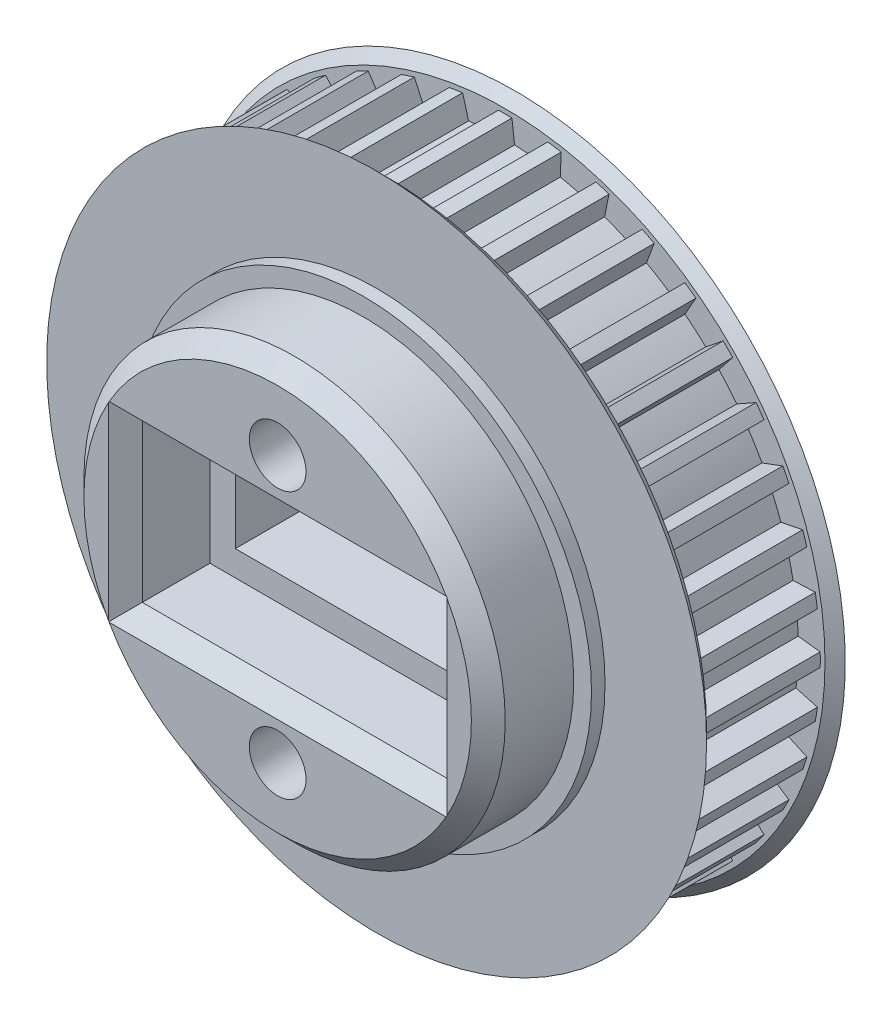
from build123d import *
from build123d.topology import SkipClean

# Parameters (mm, degrees)
CROQUIS1_R                 = 2
SALIENTE_EXTRUIR1_DEPTH    = 7
CROQUIS2_R                 = 19.5
CROQUIS2_R_2               = 2
SALIENTE_EXTRUIR2_DEPTH    = 0.6
SALIENTE_EXTRUIR4_START    = 5.8
CROQUIS4_R                 = 12.45
CROQUIS4_R_2               = 2
SALIENTE_EXTRUIR4_DEPTH    = 5.8
SALIENTE_EXTRUIR6_START    = 0.6
CROQUIS6_R                 = 19.5
CROQUIS6_R_2               = 2
SALIENTE_EXTRUIR6_DEPTH    = 0.6
SALIENTE_EXTRUIR5_START    = 0.6
CROQUIS5_R                 = 13.5
CROQUIS5_R_2               = 2
SALIENTE_EXTRUIR5_DEPTH    = 0.6
CROQUIS3_R                 = 12.45
CROQUIS3_R_2               = 2
SALIENTE_EXTRUIR7_DEPTH    = 5.85
CHAFL_N4_SIZE              = 1
CROQUIS7_R                 = 13.5
CROQUIS7_R_2               = 2
SALIENTE_EXTRUIR8_DEPTH    = 0.8
CORTAR_EXTRUIR1_DEPTH      = 31.682283161
CORTAR_EXTRUIR1_DEPTH_BACK = 31.682283161
CROQUIS8_R                 = 1.675
CROQUIS8_W                 = 15
CROQUIS8_H                 = 6.3
CORTAR_EXTRUIR2_DEPTH      = 5
REDONDEO1_R                = 2.5
CROQUIS10_W                = 18
CROQUIS10_H                = 9.3
CORTAR_EXTRUIR3_DEPTH      = 5
CHAFL_N5_SIZE              = 1
CHAFL_N6_SIZE              = 0.6


# Some blends are built 0.0001 mm under size
with BuildPart() as part:
    # Croquis1 → Saliente-Extruir1 (new body)
    with BuildSketch(Plane.XY):
        with BuildLine():
            Line((-0.4, 18.616701085), (-0.55, 17.312263428))
            ThreePointArc((-0.55, 17.312263428), (-1.358989825, 17.26760295), (-2.165006081, 17.185159693))
            Line((-2.165006081, 17.185159693), (-2.517218339, 18.450072388))
            Line((-2.517218339, 18.450072388), (-3.307369011, 18.324924816))
            Line((-3.307369011, 18.324924816), (-3.251463255, 17.013081781))
            ThreePointArc((-3.251463255, 17.013081781), (-4.043506635, 16.842417258), (-4.826702526, 16.634900292))
            Line((-4.826702526, 16.634900292), (-5.372454408, 17.829141677))
            Line((-5.372454408, 17.829141677), (-6.133299621, 17.581928081))
            Line((-6.133299621, 17.581928081), (-5.872864694, 16.294981598))
            ThreePointArc((-5.872864694, 16.294981598), (-6.628458892, 16.002515356), (-7.369549537, 15.675034438))
            Line((-7.369549537, 15.675034438), (-8.095402819, 16.769198326))
            Line((-8.095402819, 16.769198326), (-8.808208039, 16.406005926))
            Line((-8.808208039, 16.406005926), (-8.349656714, 15.175644888))
            ThreePointArc((-8.349656714, 15.175644888), (-9.050196493, 14.768578416), (-9.73093378, 14.329197213))
            Line((-9.73093378, 14.329197213), (-10.619015546, 15.296341658))
            Line((-10.619015546, 15.296341658), (-11.266229142, 14.826113456))
            Line((-11.266229142, 14.826113456), (-10.620852474, 13.682633435))
            ThreePointArc((-10.620852474, 13.682633435), (-11.24908822, 13.170990062), (-11.852710138, 12.630527597))
            Line((-11.852710138, 12.630527597), (-12.881152868, 13.446838293))
            ThreePointArc((-12.881152868, 13.446838293), (-13.167033821, 13.167033821), (-13.446838293, 12.881152868))
            Line((-13.446838293, 12.881152868), (-12.630527597, 11.852710138))
            ThreePointArc((-12.630527597, 11.852710138), (-13.170990062, 11.24908822), (-13.682633435, 10.620852474))
            Line((-13.682633435, 10.620852474), (-14.826113456, 11.266229142))
            ThreePointArc((-14.826113456, 11.266229142), (-15.064703677, 10.945147893), (-15.296341658, 10.619015546))
            Line((-15.296341658, 10.619015546), (-14.329197213, 9.73093378))
            ThreePointArc((-14.329197213, 9.73093378), (-14.768578416, 9.050196493), (-15.175644888, 8.349656714))
            Line((-15.175644888, 8.349656714), (-16.406005926, 8.808208039))
            ThreePointArc((-16.406005926, 8.808208039), (-16.591430532, 8.4537561), (-16.769198326, 8.095402819))
            Line((-16.769198326, 8.095402819), (-15.675034438, 7.369549537))
            ThreePointArc((-15.675034438, 7.369549537), (-16.002515356, 6.628458892), (-16.294981598, 5.872864694))
            Line((-16.294981598, 5.872864694), (-17.581928081, 6.133299621))
            ThreePointArc((-17.581928081, 6.133299621), (-17.709621303, 5.754204774), (-17.829141677, 5.372454408))
            Line((-17.829141677, 5.372454408), (-16.634900292, 4.826702526))
            ThreePointArc((-16.634900292, 4.826702526), (-16.842417258, 4.043506635), (-17.013081781, 3.251463255))
            Line((-17.013081781, 3.251463255), (-18.324924816, 3.307369011))
            ThreePointArc((-18.324924816, 3.307369011), (-18.391742423, 2.91296583), (-18.450072388, 2.517218339))
            Line((-18.450072388, 2.517218339), (-17.185159693, 2.165006081))
            ThreePointArc((-17.185159693, 2.165006081), (-17.26760295, 1.358989825), (-17.312263428, 0.55))
            Line((-17.312263428, 0.55), (-18.616701085, 0.4))
            ThreePointArc((-18.616701085, 0.4), (-18.620997806, 0), (-18.616701085, -0.4))
            Line((-18.616701085, -0.4), (-17.312263428, -0.55))
            ThreePointArc((-17.312263428, -0.55), (-17.26760295, -1.358989825), (-17.185159693, -2.165006081))
            Line((-17.185159693, -2.165006081), (-18.450072388, -2.517218339))
            ThreePointArc((-18.450072388, -2.517218339), (-18.391742423, -2.91296583), (-18.324924816, -3.307369011))
            Line((-18.324924816, -3.307369011), (-17.013081781, -3.251463255))
            ThreePointArc((-17.013081781, -3.251463255), (-16.842417258, -4.043506635), (-16.634900292, -4.826702526))
            Line((-16.634900292, -4.826702526), (-17.829141677, -5.372454408))
            ThreePointArc((-17.829141677, -5.372454408), (-17.709621303, -5.754204774), (-17.581928081, -6.133299621))
            Line((-17.581928081, -6.133299621), (-16.294981598, -5.872864694))
            ThreePointArc((-16.294981598, -5.872864694), (-16.002515356, -6.628458892), (-15.675034438, -7.369549537))
            Line((-15.675034438, -7.369549537), (-16.769198326, -8.095402819))
            ThreePointArc((-16.769198326, -8.095402819), (-16.591430532, -8.4537561), (-16.406005926, -8.808208039))
            Line((-16.406005926, -8.808208039), (-15.175644888, -8.349656714))
            ThreePointArc((-15.175644888, -8.349656714), (-14.768578416, -9.050196493), (-14.329197213, -9.73093378))
            Line((-14.329197213, -9.73093378), (-15.296341658, -10.619015546))
            ThreePointArc((-15.296341658, -10.619015546), (-15.064703677, -10.945147893), (-14.826113456, -11.266229142))
            Line((-14.826113456, -11.266229142), (-13.682633435, -10.620852474))
            ThreePointArc((-13.682633435, -10.620852474), (-13.170990062, -11.24908822), (-12.630527597, -11.852710138))
            Line((-12.630527597, -11.852710138), (-13.446838293, -12.881152868))
            ThreePointArc((-13.446838293, -12.881152868), (-13.167033821, -13.167033821), (-12.881152868, -13.446838293))
            Line((-12.881152868, -13.446838293), (-11.852710138, -12.630527597))
            ThreePointArc((-11.852710138, -12.630527597), (-11.24908822, -13.170990062), (-10.620852474, -13.682633435))
            Line((-10.620852474, -13.682633435), (-11.266229142, -14.826113456))
            ThreePointArc((-11.266229142, -14.826113456), (-10.945147893, -15.064703677), (-10.619015546, -15.296341658))
            Line((-10.619015546, -15.296341658), (-9.73093378, -14.329197213))
            ThreePointArc((-9.73093378, -14.329197213), (-9.050196493, -14.768578416), (-8.349656714, -15.175644888))
            Line((-8.349656714, -15.175644888), (-8.808208039, -16.406005926))
            ThreePointArc((-8.808208039, -16.406005926), (-8.4537561, -16.591430532), (-8.095402819, -16.769198326))
            Line((-8.095402819, -16.769198326), (-7.369549537, -15.675034438))
            ThreePointArc((-7.369549537, -15.675034438), (-6.628458892, -16.002515356), (-5.872864694, -16.294981598))
            Line((-5.872864694, -16.294981598), (-6.133299621, -17.581928081))
            ThreePointArc((-6.133299621, -17.581928081), (-5.754204774, -17.709621303), (-5.372454408, -17.829141677))
            Line((-5.372454408, -17.829141677), (-4.826702526, -16.634900292))
            ThreePointArc((-4.826702526, -16.634900292), (-4.043506635, -16.842417258), (-3.251463255, -17.013081781))
            Line((-3.251463255, -17.013081781), (-3.307369011, -18.324924816))
            ThreePointArc((-3.307369011, -18.324924816), (-2.91296583, -18.391742423), (-2.517218339, -18.450072388))
            Line((-2.517218339, -18.450072388), (-2.165006081, -17.185159693))
            ThreePointArc((-2.165006081, -17.185159693), (-1.358989825, -17.26760295), (-0.55, -17.312263428))
            Line((-0.55, -17.312263428), (-0.4, -18.616701085))
            ThreePointArc((-0.4, -18.616701085), (0, -18.620997806), (0.4, -18.616701085))
            Line((0.4, -18.616701085), (0.55, -17.312263428))
            ThreePointArc((0.55, -17.312263428), (1.358989825, -17.26760295), (2.165006081, -17.185159693))
            Line((2.165006081, -17.185159693), (2.517218339, -18.450072388))
            ThreePointArc((2.517218339, -18.450072388), (2.91296583, -18.391742423), (3.307369011, -18.324924816))
            Line((3.307369011, -18.324924816), (3.251463255, -17.013081781))
            ThreePointArc((3.251463255, -17.013081781), (4.043506635, -16.842417258), (4.826702526, -16.634900292))
            Line((4.826702526, -16.634900292), (5.372454408, -17.829141677))
            ThreePointArc((5.372454408, -17.829141677), (5.754204774, -17.709621303), (6.133299621, -17.581928081))
            Line((6.133299621, -17.581928081), (5.872864694, -16.294981598))
            ThreePointArc((5.872864694, -16.294981598), (6.628458892, -16.002515356), (7.369549537, -15.675034438))
            Line((7.369549537, -15.675034438), (8.095402819, -16.769198326))
            ThreePointArc((8.095402819, -16.769198326), (8.4537561, -16.591430532), (8.808208039, -16.406005926))
            Line((8.808208039, -16.406005926), (8.349656714, -15.175644888))
            ThreePointArc((8.349656714, -15.175644888), (9.050196493, -14.768578416), (9.73093378, -14.329197213))
            Line((9.73093378, -14.329197213), (10.619015546, -15.296341658))
            ThreePointArc((10.619015546, -15.296341658), (10.945147893, -15.064703677), (11.266229142, -14.826113456))
            Line((11.266229142, -14.826113456), (10.620852474, -13.682633435))
            ThreePointArc((10.620852474, -13.682633435), (11.24908822, -13.170990062), (11.852710138, -12.630527597))
            Line((11.852710138, -12.630527597), (12.881152868, -13.446838293))
            ThreePointArc((12.881152868, -13.446838293), (13.167033821, -13.167033821), (13.446838293, -12.881152868))
            Line((13.446838293, -12.881152868), (12.630527597, -11.852710138))
            ThreePointArc((12.630527597, -11.852710138), (13.170990062, -11.24908822), (13.682633435, -10.620852474))
            Line((13.682633435, -10.620852474), (14.826113456, -11.266229142))
            ThreePointArc((14.826113456, -11.266229142), (15.064703677, -10.945147893), (15.296341658, -10.619015546))
            Line((15.296341658, -10.619015546), (14.329197213, -9.73093378))
            ThreePointArc((14.329197213, -9.73093378), (14.768578416, -9.050196493), (15.175644888, -8.349656714))
            Line((15.175644888, -8.349656714), (16.406005926, -8.808208039))
            ThreePointArc((16.406005926, -8.808208039), (16.591430532, -8.4537561), (16.769198326, -8.095402819))
            Line((16.769198326, -8.095402819), (15.675034438, -7.369549537))
            ThreePointArc((15.675034438, -7.369549537), (16.002515356, -6.628458892), (16.294981598, -5.872864694))
            Line((16.294981598, -5.872864694), (17.581928081, -6.133299621))
            ThreePointArc((17.581928081, -6.133299621), (17.709621303, -5.754204774), (17.829141677, -5.372454408))
            Line((17.829141677, -5.372454408), (16.634900292, -4.826702526))
            ThreePointArc((16.634900292, -4.826702526), (16.842417258, -4.043506635), (17.013081781, -3.251463255))
            Line((17.013081781, -3.251463255), (18.324924816, -3.307369011))
            ThreePointArc((18.324924816, -3.307369011), (18.391742423, -2.91296583), (18.450072388, -2.517218339))
            Line((18.450072388, -2.517218339), (17.185159693, -2.165006081))
            ThreePointArc((17.185159693, -2.165006081), (17.26760295, -1.358989825), (17.312263428, -0.55))
            Line((17.312263428, -0.55), (18.616701085, -0.4))
            ThreePointArc((18.616701085, -0.4), (18.620997806, 0), (18.616701085, 0.4))
            Line((18.616701085, 0.4), (17.312263428, 0.55))
            ThreePointArc((17.312263428, 0.55), (17.26760295, 1.358989825), (17.185159693, 2.165006081))
            Line((17.185159693, 2.165006081), (18.450072388, 2.517218339))
            ThreePointArc((18.450072388, 2.517218339), (18.391742423, 2.91296583), (18.324924816, 3.307369011))
            Line((18.324924816, 3.307369011), (17.013081781, 3.251463255))
            ThreePointArc((17.013081781, 3.251463255), (16.842417258, 4.043506635), (16.634900292, 4.826702526))
            Line((16.634900292, 4.826702526), (17.829141677, 5.372454408))
            ThreePointArc((17.829141677, 5.372454408), (17.709621303, 5.754204774), (17.581928081, 6.133299621))
            Line((17.581928081, 6.133299621), (16.294981598, 5.872864694))
            ThreePointArc((16.294981598, 5.872864694), (16.002515356, 6.628458892), (15.675034438, 7.369549537))
            Line((15.675034438, 7.369549537), (16.769198326, 8.095402819))
            ThreePointArc((16.769198326, 8.095402819), (16.591430532, 8.4537561), (16.406005926, 8.808208039))
            Line((16.406005926, 8.808208039), (15.175644888, 8.349656714))
            ThreePointArc((15.175644888, 8.349656714), (14.768578416, 9.050196493), (14.329197213, 9.73093378))
            Line((14.329197213, 9.73093378), (15.296341658, 10.619015546))
            ThreePointArc((15.296341658, 10.619015546), (15.064703677, 10.945147893), (14.826113456, 11.266229142))
            Line((14.826113456, 11.266229142), (13.682633435, 10.620852474))
            ThreePointArc((13.682633435, 10.620852474), (13.170990062, 11.24908822), (12.630527597, 11.852710138))
            Line((12.630527597, 11.852710138), (13.446838293, 12.881152868))
            ThreePointArc((13.446838293, 12.881152868), (13.167033821, 13.167033821), (12.881152868, 13.446838293))
            Line((12.881152868, 13.446838293), (11.852710138, 12.630527597))
            ThreePointArc((11.852710138, 12.630527597), (11.24908822, 13.170990062), (10.620852474, 13.682633435))
            Line((10.620852474, 13.682633435), (11.266229142, 14.826113456))
            ThreePointArc((11.266229142, 14.826113456), (10.945147893, 15.064703677), (10.619015546, 15.296341658))
            Line((10.619015546, 15.296341658), (9.73093378, 14.329197213))
            ThreePointArc((9.73093378, 14.329197213), (9.050196493, 14.768578416), (8.349656714, 15.175644888))
            Line((8.349656714, 15.175644888), (8.808208039, 16.406005926))
            ThreePointArc((8.808208039, 16.406005926), (8.4537561, 16.591430532), (8.095402819, 16.769198326))
            Line((8.095402819, 16.769198326), (7.369549537, 15.675034438))
            ThreePointArc((7.369549537, 15.675034438), (6.628458892, 16.002515356), (5.872864694, 16.294981598))
            Line((5.872864694, 16.294981598), (6.133299621, 17.581928081))
            ThreePointArc((6.133299621, 17.581928081), (5.754204774, 17.709621303), (5.372454408, 17.829141677))
            Line((5.372454408, 17.829141677), (4.826702526, 16.634900292))
            ThreePointArc((4.826702526, 16.634900292), (4.043506635, 16.842417258), (3.251463255, 17.013081781))
            Line((3.251463255, 17.013081781), (3.307369011, 18.324924816))
            ThreePointArc((3.307369011, 18.324924816), (2.91296583, 18.391742423), (2.517218339, 18.450072388))
            Line((2.517218339, 18.450072388), (2.165006081, 17.185159693))
            ThreePointArc((2.165006081, 17.185159693), (1.358989825, 17.26760295), (0.55, 17.312263428))
            Line((0.55, 17.312263428), (0.4, 18.616701085))
            ThreePointArc((0.4, 18.616701085), (0, 18.620997806), (-0.4, 18.616701085))
        make_face()
        Circle(CROQUIS1_R, mode=Mode.SUBTRACT)
    extrude(amount=SALIENTE_EXTRUIR1_DEPTH)

    # Croquis2 → Saliente-Extruir2 (add)
    with BuildSketch(Plane.XY.offset(7)):
        Circle(CROQUIS2_R)
        Circle(CROQUIS2_R_2, mode=Mode.SUBTRACT)
    extrude(amount=SALIENTE_EXTRUIR2_DEPTH)

    # Croquis4 → Saliente-Extruir4 (add)
    with BuildSketch(Plane(origin=(0, 0, 0), x_dir=(-1, 0, 0), z_dir=(0, 0, -1)).offset(SALIENTE_EXTRUIR4_START)):
        with Locations(Location((0, 0, 0), (0, 0, 180))):
            Circle(CROQUIS4_R)
        Circle(CROQUIS4_R_2, mode=Mode.SUBTRACT)
    extrude(amount=-SALIENTE_EXTRUIR4_DEPTH)

    # Croquis6 → Saliente-Extruir6 (add)
    with SkipClean():  # the faces are left unmerged after this step: merging them gives an invalid solid
        with BuildSketch(Plane(origin=(0, 0, 0), x_dir=(-1, 0, 0), z_dir=(0, 0, -1)).offset(SALIENTE_EXTRUIR6_START)):
            with Locations(Location((0, 0, 0), (0, 0, 180))):
                Circle(CROQUIS6_R)
            Circle(CROQUIS6_R_2, mode=Mode.SUBTRACT)
        extrude(amount=-SALIENTE_EXTRUIR6_DEPTH)

    # Croquis5 → Saliente-Extruir5 (add)
    with SkipClean():  # the faces are left unmerged after this step: merging them gives an invalid solid
        with BuildSketch(Plane(origin=(0, 0, -0.6), x_dir=(-1, 0, 0), z_dir=(0, 0, -1)).offset(SALIENTE_EXTRUIR5_START)):
            Circle(CROQUIS5_R)
            Circle(CROQUIS5_R_2, mode=Mode.SUBTRACT)
        extrude(amount=-SALIENTE_EXTRUIR5_DEPTH)

    # Croquis3 → Saliente-Extruir7 (add)
    with BuildSketch(Plane.XY.offset(7.6)):
        with Locations(Location((0, 0, 0), (0, 0, 180))):
            Circle(CROQUIS3_R)
        with Locations(Location((0, 0, 0), (0, 0, 180))):
            Circle(CROQUIS3_R_2, mode=Mode.SUBTRACT)
    extrude(amount=SALIENTE_EXTRUIR7_DEPTH)

    # Chaflán4
    chafl_n4_edges = [part.edges().sort_by_distance(p)[0] for p in [
        (-12.45, 0, -5.8),
        (12.45, 0, 13.45),
    ]]
    chamfer(chafl_n4_edges, length=CHAFL_N4_SIZE)

    # Croquis7 → Saliente-Extruir8 (add)
    with BuildSketch(Plane.XY.offset(7.6)):
        with Locations(Location((0, 0, 0), (0, 0, 180))):
            Circle(CROQUIS7_R)
        with Locations(Location((0, 0, 0), (0, 0, 180))):
            Circle(CROQUIS7_R_2, mode=Mode.SUBTRACT)
    extrude(amount=SALIENTE_EXTRUIR8_DEPTH)

    # Croquis8 → Cortar-Extruir1 (cut, two sides: drawn at the far end of the back side and taken through both)
    with BuildSketch(Plane.XY.offset(-CORTAR_EXTRUIR1_DEPTH_BACK)):
        with Locations((0, 7.875631857)):
            Circle(CROQUIS8_R)
        with Locations((0, -7.875631857)):
            Circle(CROQUIS8_R)
        Rectangle(CROQUIS8_W, CROQUIS8_H)
    extrude(amount=CORTAR_EXTRUIR1_DEPTH + CORTAR_EXTRUIR1_DEPTH_BACK, mode=Mode.SUBTRACT)

    # Croquis9 → Cortar-Extruir2 (cut)
    with BuildSketch(Plane(origin=(0, 0, -5.8), x_dir=(-1, 0, 0), z_dir=(0, 0, -1))):
        Polygon((2.33826859, 3.825631857), (4.67653718, 7.875631857), (2.33826859, 11.925631857), (-2.33826859, 11.925631857), (-4.67653718, 7.875631857), (-2.33826859, 3.825631857), align=None)
        Polygon((2.33826859, -11.925631857), (4.67653718, -7.875631857), (2.33826859, -3.825631857), (-2.33826859, -3.825631857), (-4.67653718, -7.875631857), (-2.33826859, -11.925631857), align=None)
    extrude(amount=-CORTAR_EXTRUIR2_DEPTH, mode=Mode.SUBTRACT)

    # Redondeo1
    redondeo1_edges = [part.edges().sort_by_distance(p)[0] for p in [
        (0, 3.825631857, -0.8),
        (3.507402885, 5.850631857, -0.8),
        (3.507402885, 9.900631857, -0.8),
        (0, 11.925631857, -0.8),
        (-3.507402885, 9.900631857, -0.8),
        (-3.507402885, 5.850631857, -0.8),
        (0, -11.925631857, -0.8),
        (3.507402885, -9.900631857, -0.8),
        (3.507402885, -5.850631857, -0.8),
        (0, -3.825631857, -0.8),
        (-3.507402885, -5.850631857, -0.8),
        (-3.507402885, -9.900631857, -0.8),
    ]]
    fillet(redondeo1_edges, radius=REDONDEO1_R)

    # Croquis10 → Cortar-Extruir3 (cut)
    with BuildSketch(Plane.XY.offset(13.45)):
        Rectangle(CROQUIS10_W, CROQUIS10_H)
    extrude(amount=-CORTAR_EXTRUIR3_DEPTH, mode=Mode.SUBTRACT)

    # Chaflán5
    # the kernel refuses this chamfer: 1 mm, written as the material it takes off along each edge
    with BuildSketch(Plane(origin=(-7.5, -3.15, -5.8), x_dir=(-0.9996219169112968, 0, -0.02749587661058651), z_dir=(0, 1, 0)), Plane(origin=(7.5, 3.15, -5.8), x_dir=(0.9996219169112968, 0, -0.02749587661058651), z_dir=(0, -1, 0))) as chafl_n5_piece_1:
        Polygon((CHAFL_N5_SIZE * 0.999621916911, CHAFL_N5_SIZE * 0.0274958766106), (-CHAFL_N5_SIZE * 0.0274958766106, CHAFL_N5_SIZE * 0.999621916911), (0, 0), align=None)
    extrude(amount=6.3, mode=Mode.SUBTRACT)
    with BuildSketch(Plane(origin=(-7.5, 3.15, -5.8), x_dir=(0, 0.9996219169112968, -0.027495876610586487), z_dir=(1, 0, 0)), Plane(origin=(7.5, -3.15, -5.8), x_dir=(0, -0.9996219169112968, -0.027495876610586487), z_dir=(-1, 0, 0))) as chafl_n5_piece_2:
        Polygon((CHAFL_N5_SIZE * 0.999621916911, CHAFL_N5_SIZE * 0.0274958766106), (-CHAFL_N5_SIZE * 0.0274958766106, CHAFL_N5_SIZE * 0.999621916911), (0, 0), align=None)
    extrude(amount=15, mode=Mode.SUBTRACT)
    with BuildSketch(Plane(origin=(9, -4.65, 13.45), x_dir=(0.9996219169112968, 0, 0.027495876610585647), z_dir=(0, 1, 0)), Plane(origin=(-9, 4.65, 13.45), x_dir=(-0.9996219169112968, 0, 0.027495876610585647), z_dir=(0, -1, 0))) as chafl_n5_piece_3:
        Polygon((CHAFL_N5_SIZE * 0.999621916911, CHAFL_N5_SIZE * 0.0274958766106), (-CHAFL_N5_SIZE * 0.0274958766106, CHAFL_N5_SIZE * 0.999621916911), (0, 0), align=None)
    extrude(amount=9.3, mode=Mode.SUBTRACT)
    with BuildSketch(Plane(origin=(9, 4.65, 13.45), x_dir=(0, 0.9996219169112968, 0.027495876610585623), z_dir=(-1, 0, 0)), Plane(origin=(-9, -4.65, 13.45), x_dir=(0, -0.9996219169112968, 0.027495876610585623), z_dir=(1, 0, 0))) as chafl_n5_piece_4:
        Polygon((CHAFL_N5_SIZE * 0.999621916911, CHAFL_N5_SIZE * 0.0274958766106), (-CHAFL_N5_SIZE * 0.0274958766106, CHAFL_N5_SIZE * 0.999621916911), (0, 0), align=None)
    extrude(amount=18, mode=Mode.SUBTRACT)
    with BuildSketch(Plane(origin=(-7.5, -5.721682988, -5.8), x_dir=(-0.9996219169112968, 0, -0.02749587661058651), z_dir=(0, 1, 0))) as chafl_n5_piece_5a_section:
        Polygon((CHAFL_N5_SIZE * 0.999621916911, CHAFL_N5_SIZE * 0.0274958766106), (-CHAFL_N5_SIZE * 0.0274958766106, CHAFL_N5_SIZE * 0.999621916911), (0, 0), align=None)
    chafl_n5_piece_5a = extrude(amount=8.871682988, mode=Mode.PRIVATE)
    chafl_n5_piece_5a = split(chafl_n5_piece_5a, bisect_by=Plane(origin=(-7.829793627, -3.15, -5.470206373), z_dir=(0, -1, 0)), keep=Keep.TOP, mode=Mode.PRIVATE)
    with BuildSketch(Plane(origin=(7.5, -3.15, -5.8), x_dir=(0, -0.9996219169112968, -0.027495876610586487), z_dir=(-1, 0, 0))) as chafl_n5_piece_5b_section:
        Polygon((CHAFL_N5_SIZE * 0.999621916911, CHAFL_N5_SIZE * 0.0274958766106), (-CHAFL_N5_SIZE * 0.0274958766106, CHAFL_N5_SIZE * 0.999621916911), (0, 0), align=None)
    chafl_n5_piece_5b = extrude(amount=17.571682988, mode=Mode.PRIVATE)
    chafl_n5_piece_5b = split(chafl_n5_piece_5b, bisect_by=Plane(origin=(-7.5, -3.479793627, -5.470206373), z_dir=(-1, 0, 0)), keep=Keep.TOP, mode=Mode.PRIVATE)
    chafl_n5_piece_5 = chafl_n5_piece_5a & chafl_n5_piece_5b
    add(chafl_n5_piece_5, mode=Mode.SUBTRACT)
    with BuildSketch(Plane(origin=(-10.071682988, 3.15, -5.8), x_dir=(0, 0.9996219169112968, -0.027495876610586487), z_dir=(1, 0, 0))) as chafl_n5_piece_6a_section:
        Polygon((CHAFL_N5_SIZE * 0.999621916911, CHAFL_N5_SIZE * 0.0274958766106), (-CHAFL_N5_SIZE * 0.0274958766106, CHAFL_N5_SIZE * 0.999621916911), (0, 0), align=None)
    chafl_n5_piece_6a = extrude(amount=17.571682988, mode=Mode.PRIVATE)
    chafl_n5_piece_6a = split(chafl_n5_piece_6a, bisect_by=Plane(origin=(-7.5, 3.479793627, -5.470206373), z_dir=(-1, 0, 0)), keep=Keep.TOP, mode=Mode.PRIVATE)
    with BuildSketch(Plane(origin=(-7.5, -3.15, -5.8), x_dir=(-0.9996219169112968, 0, -0.02749587661058651), z_dir=(0, 1, 0))) as chafl_n5_piece_6b_section:
        Polygon((CHAFL_N5_SIZE * 0.999621916911, CHAFL_N5_SIZE * 0.0274958766106), (-CHAFL_N5_SIZE * 0.0274958766106, CHAFL_N5_SIZE * 0.999621916911), (0, 0), align=None)
    chafl_n5_piece_6b = extrude(amount=8.871682988, mode=Mode.PRIVATE)
    chafl_n5_piece_6b = split(chafl_n5_piece_6b, bisect_by=Plane(origin=(-7.829793627, 3.15, -5.470206373), z_dir=(0, 1, 0)), keep=Keep.TOP, mode=Mode.PRIVATE)
    chafl_n5_piece_6 = chafl_n5_piece_6a & chafl_n5_piece_6b
    add(chafl_n5_piece_6, mode=Mode.SUBTRACT)
    with BuildSketch(Plane(origin=(-7.5, 3.15, -5.8), x_dir=(0, 0.9996219169112968, -0.027495876610586487), z_dir=(1, 0, 0))) as chafl_n5_piece_7a_section:
        Polygon((CHAFL_N5_SIZE * 0.999621916911, CHAFL_N5_SIZE * 0.0274958766106), (-CHAFL_N5_SIZE * 0.0274958766106, CHAFL_N5_SIZE * 0.999621916911), (0, 0), align=None)
    chafl_n5_piece_7a = extrude(amount=17.571682988, mode=Mode.PRIVATE)
    chafl_n5_piece_7a = split(chafl_n5_piece_7a, bisect_by=Plane(origin=(7.5, 3.479793627, -5.470206373), z_dir=(1, 0, 0)), keep=Keep.TOP, mode=Mode.PRIVATE)
    with BuildSketch(Plane(origin=(7.5, 5.721682988, -5.8), x_dir=(0.9996219169112968, 0, -0.02749587661058651), z_dir=(0, -1, 0))) as chafl_n5_piece_7b_section:
        Polygon((CHAFL_N5_SIZE * 0.999621916911, CHAFL_N5_SIZE * 0.0274958766106), (-CHAFL_N5_SIZE * 0.0274958766106, CHAFL_N5_SIZE * 0.999621916911), (0, 0), align=None)
    chafl_n5_piece_7b = extrude(amount=8.871682988, mode=Mode.PRIVATE)
    chafl_n5_piece_7b = split(chafl_n5_piece_7b, bisect_by=Plane(origin=(7.829793627, 3.15, -5.470206373), z_dir=(0, 1, 0)), keep=Keep.TOP, mode=Mode.PRIVATE)
    chafl_n5_piece_7 = chafl_n5_piece_7a & chafl_n5_piece_7b
    add(chafl_n5_piece_7, mode=Mode.SUBTRACT)
    with BuildSketch(Plane(origin=(7.5, 3.15, -5.8), x_dir=(0.9996219169112968, 0, -0.02749587661058651), z_dir=(0, -1, 0))) as chafl_n5_piece_8a_section:
        Polygon((CHAFL_N5_SIZE * 0.999621916911, CHAFL_N5_SIZE * 0.0274958766106), (-CHAFL_N5_SIZE * 0.0274958766106, CHAFL_N5_SIZE * 0.999621916911), (0, 0), align=None)
    chafl_n5_piece_8a = extrude(amount=8.871682988, mode=Mode.PRIVATE)
    chafl_n5_piece_8a = split(chafl_n5_piece_8a, bisect_by=Plane(origin=(7.829793627, -3.15, -5.470206373), z_dir=(0, -1, 0)), keep=Keep.TOP, mode=Mode.PRIVATE)
    with BuildSketch(Plane(origin=(10.071682988, -3.15, -5.8), x_dir=(0, -0.9996219169112968, -0.027495876610586487), z_dir=(-1, 0, 0))) as chafl_n5_piece_8b_section:
        Polygon((CHAFL_N5_SIZE * 0.999621916911, CHAFL_N5_SIZE * 0.0274958766106), (-CHAFL_N5_SIZE * 0.0274958766106, CHAFL_N5_SIZE * 0.999621916911), (0, 0), align=None)
    chafl_n5_piece_8b = extrude(amount=17.571682988, mode=Mode.PRIVATE)
    chafl_n5_piece_8b = split(chafl_n5_piece_8b, bisect_by=Plane(origin=(7.5, -3.479793627, -5.470206373), z_dir=(1, 0, 0)), keep=Keep.TOP, mode=Mode.PRIVATE)
    chafl_n5_piece_8 = chafl_n5_piece_8a & chafl_n5_piece_8b
    add(chafl_n5_piece_8, mode=Mode.SUBTRACT)
    with BuildSketch(Plane(origin=(-9, -4.65, 13.45), x_dir=(0, -0.9996219169112968, 0.027495876610585623), z_dir=(1, 0, 0))) as chafl_n5_piece_9a_section:
        Polygon((CHAFL_N5_SIZE * 0.999621916911, CHAFL_N5_SIZE * 0.0274958766106), (-CHAFL_N5_SIZE * 0.0274958766106, CHAFL_N5_SIZE * 0.999621916911), (0, 0), align=None)
    chafl_n5_piece_9a = extrude(amount=20.571682988, mode=Mode.PRIVATE)
    chafl_n5_piece_9a = split(chafl_n5_piece_9a, bisect_by=Plane(origin=(9, -4.979793627, 13.120206373), z_dir=(1, 0, 0)), keep=Keep.TOP, mode=Mode.PRIVATE)
    with BuildSketch(Plane(origin=(9, -7.221682988, 13.45), x_dir=(0.9996219169112968, 0, 0.027495876610585647), z_dir=(0, 1, 0))) as chafl_n5_piece_9b_section:
        Polygon((CHAFL_N5_SIZE * 0.999621916911, CHAFL_N5_SIZE * 0.0274958766106), (-CHAFL_N5_SIZE * 0.0274958766106, CHAFL_N5_SIZE * 0.999621916911), (0, 0), align=None)
    chafl_n5_piece_9b = extrude(amount=11.871682988, mode=Mode.PRIVATE)
    chafl_n5_piece_9b = split(chafl_n5_piece_9b, bisect_by=Plane(origin=(9.329793627, -4.65, 13.120206373), z_dir=(0, -1, 0)), keep=Keep.TOP, mode=Mode.PRIVATE)
    chafl_n5_piece_9 = chafl_n5_piece_9a & chafl_n5_piece_9b
    add(chafl_n5_piece_9, mode=Mode.SUBTRACT)
    with BuildSketch(Plane(origin=(11.571682988, 4.65, 13.45), x_dir=(0, 0.9996219169112968, 0.027495876610585623), z_dir=(-1, 0, 0))) as chafl_n5_piece_10a_section:
        Polygon((CHAFL_N5_SIZE * 0.999621916911, CHAFL_N5_SIZE * 0.0274958766106), (-CHAFL_N5_SIZE * 0.0274958766106, CHAFL_N5_SIZE * 0.999621916911), (0, 0), align=None)
    chafl_n5_piece_10a = extrude(amount=20.571682988, mode=Mode.PRIVATE)
    chafl_n5_piece_10a = split(chafl_n5_piece_10a, bisect_by=Plane(origin=(9, 4.979793627, 13.120206373), z_dir=(1, 0, 0)), keep=Keep.TOP, mode=Mode.PRIVATE)
    with BuildSketch(Plane(origin=(9, -4.65, 13.45), x_dir=(0.9996219169112968, 0, 0.027495876610585647), z_dir=(0, 1, 0))) as chafl_n5_piece_10b_section:
        Polygon((CHAFL_N5_SIZE * 0.999621916911, CHAFL_N5_SIZE * 0.0274958766106), (-CHAFL_N5_SIZE * 0.0274958766106, CHAFL_N5_SIZE * 0.999621916911), (0, 0), align=None)
    chafl_n5_piece_10b = extrude(amount=11.871682988, mode=Mode.PRIVATE)
    chafl_n5_piece_10b = split(chafl_n5_piece_10b, bisect_by=Plane(origin=(9.329793627, 4.65, 13.120206373), z_dir=(0, 1, 0)), keep=Keep.TOP, mode=Mode.PRIVATE)
    chafl_n5_piece_10 = chafl_n5_piece_10a & chafl_n5_piece_10b
    add(chafl_n5_piece_10, mode=Mode.SUBTRACT)
    with BuildSketch(Plane(origin=(9, 4.65, 13.45), x_dir=(0, 0.9996219169112968, 0.027495876610585623), z_dir=(-1, 0, 0))) as chafl_n5_piece_11a_section:
        Polygon((CHAFL_N5_SIZE * 0.999621916911, CHAFL_N5_SIZE * 0.0274958766106), (-CHAFL_N5_SIZE * 0.0274958766106, CHAFL_N5_SIZE * 0.999621916911), (0, 0), align=None)
    chafl_n5_piece_11a = extrude(amount=20.571682988, mode=Mode.PRIVATE)
    chafl_n5_piece_11a = split(chafl_n5_piece_11a, bisect_by=Plane(origin=(-9, 4.979793627, 13.120206373), z_dir=(-1, 0, 0)), keep=Keep.TOP, mode=Mode.PRIVATE)
    with BuildSketch(Plane(origin=(-9, 7.221682988, 13.45), x_dir=(-0.9996219169112968, 0, 0.027495876610585647), z_dir=(0, -1, 0))) as chafl_n5_piece_11b_section:
        Polygon((CHAFL_N5_SIZE * 0.999621916911, CHAFL_N5_SIZE * 0.0274958766106), (-CHAFL_N5_SIZE * 0.0274958766106, CHAFL_N5_SIZE * 0.999621916911), (0, 0), align=None)
    chafl_n5_piece_11b = extrude(amount=11.871682988, mode=Mode.PRIVATE)
    chafl_n5_piece_11b = split(chafl_n5_piece_11b, bisect_by=Plane(origin=(-9.329793627, 4.65, 13.120206373), z_dir=(0, 1, 0)), keep=Keep.TOP, mode=Mode.PRIVATE)
    chafl_n5_piece_11 = chafl_n5_piece_11a & chafl_n5_piece_11b
    add(chafl_n5_piece_11, mode=Mode.SUBTRACT)
    with BuildSketch(Plane(origin=(-9, 4.65, 13.45), x_dir=(-0.9996219169112968, 0, 0.027495876610585647), z_dir=(0, -1, 0))) as chafl_n5_piece_12a_section:
        Polygon((CHAFL_N5_SIZE * 0.999621916911, CHAFL_N5_SIZE * 0.0274958766106), (-CHAFL_N5_SIZE * 0.0274958766106, CHAFL_N5_SIZE * 0.999621916911), (0, 0), align=None)
    chafl_n5_piece_12a = extrude(amount=11.871682988, mode=Mode.PRIVATE)
    chafl_n5_piece_12a = split(chafl_n5_piece_12a, bisect_by=Plane(origin=(-9.329793627, -4.65, 13.120206373), z_dir=(0, -1, 0)), keep=Keep.TOP, mode=Mode.PRIVATE)
    with BuildSketch(Plane(origin=(-11.571682988, -4.65, 13.45), x_dir=(0, -0.9996219169112968, 0.027495876610585623), z_dir=(1, 0, 0))) as chafl_n5_piece_12b_section:
        Polygon((CHAFL_N5_SIZE * 0.999621916911, CHAFL_N5_SIZE * 0.0274958766106), (-CHAFL_N5_SIZE * 0.0274958766106, CHAFL_N5_SIZE * 0.999621916911), (0, 0), align=None)
    chafl_n5_piece_12b = extrude(amount=20.571682988, mode=Mode.PRIVATE)
    chafl_n5_piece_12b = split(chafl_n5_piece_12b, bisect_by=Plane(origin=(-9, -4.979793627, 13.120206373), z_dir=(-1, 0, 0)), keep=Keep.TOP, mode=Mode.PRIVATE)
    chafl_n5_piece_12 = chafl_n5_piece_12a & chafl_n5_piece_12b
    add(chafl_n5_piece_12, mode=Mode.SUBTRACT)

    # Chaflán6
    chafl_n6_edges = [part.edges().sort_by_distance(p)[0] for p in [
        (-19.5, 0, 7),
        (-19.5, 0, 0),
    ]]
    chamfer(chafl_n6_edges, length=CHAFL_N6_SIZE - 0.0001)  # a hair under: the kernel refuses the full size


solid = part.part
